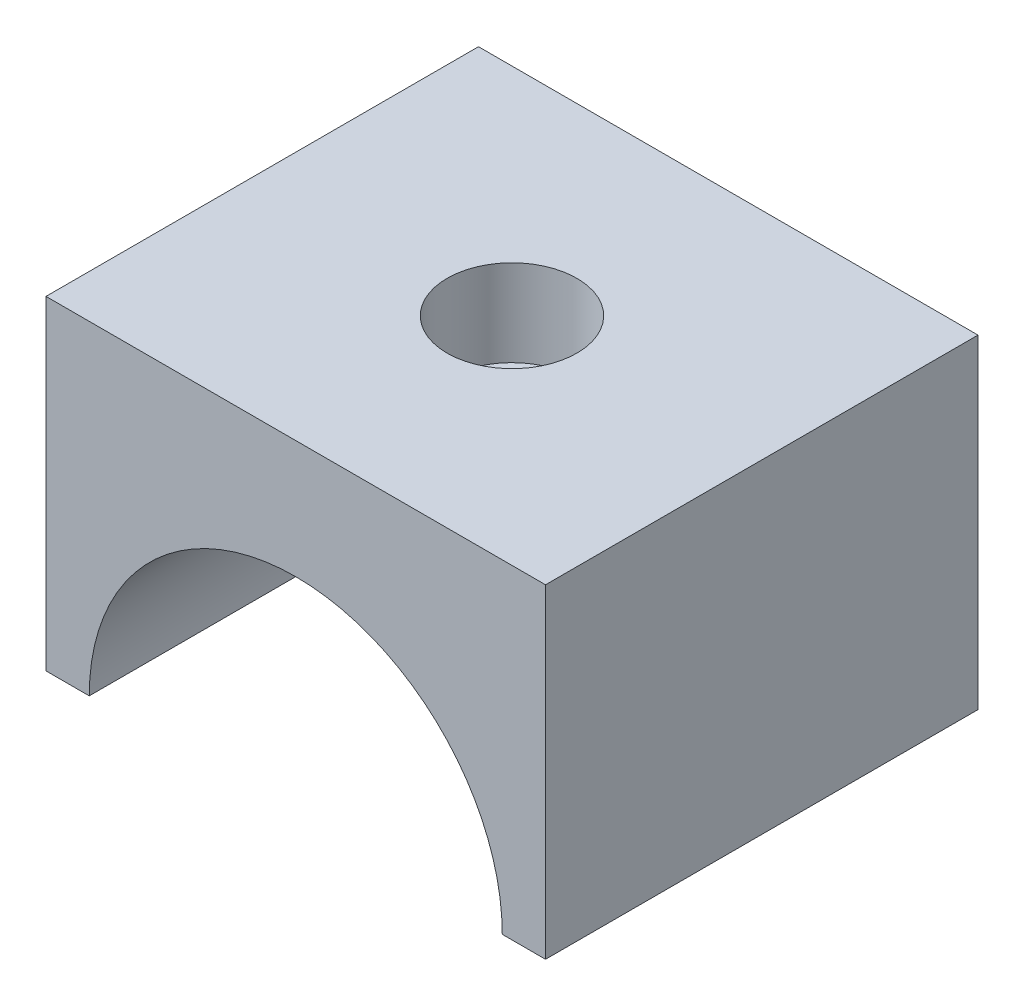
from build123d import *

# Parameters (mm, degrees)
BOSS_EXTRUDE1_DEPTH = 20
SKETCH3_R           = 1.6
CUT_EXTRUDE1_DEPTH  = 20
SKETCH4_R           = 3
CUT_EXTRUDE2_DEPTH  = 4


with BuildPart() as part:
    # Sketch2 → Boss-Extrude1 (new body)
    with BuildSketch(Plane.XY):
        with BuildLine():
            Line((0, 0), (-2, 0))
            Line((-2, 0), (-2, 15))
            Line((-2, 15), (21.1, 15))
            Line((21.1, 15), (21.1, 0))
            Line((21.1, 0), (19.1, 0))
            ThreePointArc((19.1, 0), (9.55, 9.55), (0, 0))
        make_face()
    extrude(amount=-BOSS_EXTRUDE1_DEPTH)

    # Sketch3 → Cut-Extrude1 (cut)
    with BuildSketch(Plane(origin=(0, 15, 0), x_dir=(1, 0, 0), z_dir=(0, 1, 0))):
        with Locations((9.55, 10)):
            Circle(SKETCH3_R)
    extrude(amount=-CUT_EXTRUDE1_DEPTH, mode=Mode.SUBTRACT)

    # Sketch4 → Cut-Extrude2 (cut)
    with BuildSketch(Plane(origin=(0, 15, 0), x_dir=(1, 0, 0), z_dir=(0, 1, 0))):
        with Locations((9.55, 10)):
            Circle(SKETCH4_R)
    extrude(amount=-CUT_EXTRUDE2_DEPTH, mode=Mode.SUBTRACT)


solid = part.part
